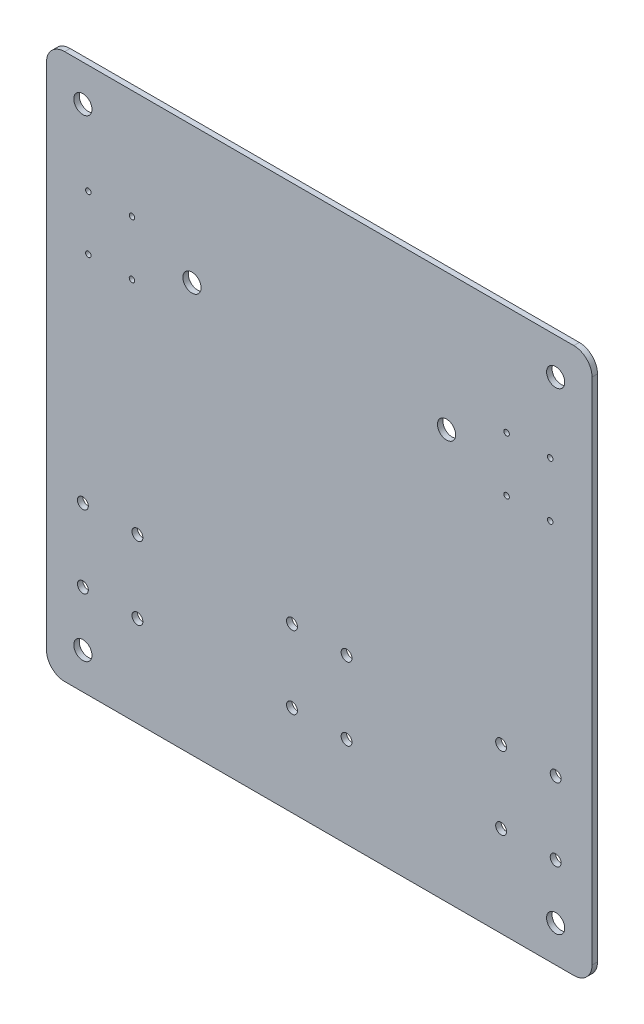
from build123d import *

# Parameters (mm, degrees)
SKETCH_1_W               = 300
SKETCH_1_H               = 300
EXTRUDE_1_DEPTH          = 3
SKETCH_2_R               = 1.5
CUT_EXTRUDE_1_DEPTH      = 213.153246499
FILLET_1_R               = 10
SKETCH_3_R               = 5
CUT_EXTRUDE_2_DEPTH      = 213.153246499
MIRROR_3_COPY_1_SKETCH_R = 5
MIRROR_3_COPY_1_DEPTH    = 213.153246499
SKETCH_4_R               = 5
CUT_EXTRUDE_3_DEPTH      = 213.153246499
SKETCH_5_R               = 3
CUT_EXTRUDE_4_DEPTH      = 213.153246499
SKETCH_6_R               = 3
CUT_EXTRUDE_5_DEPTH      = 213.153246499


with BuildPart() as part:
    # 草图1 → 凸台-拉伸1 (new body)
    with BuildSketch(Plane.XY):
        Rectangle(SKETCH_1_W, SKETCH_1_H)
    extrude(amount=EXTRUDE_1_DEPTH)

    # 草图2 → 切除-拉伸1 (cut, through all)
    with BuildSketch(Plane.XY.offset(3)):
        with Locations((103, 90)):
            Circle(SKETCH_2_R)
        with Locations((127, 90)):
            Circle(SKETCH_2_R)
        with Locations((103, 60)):
            Circle(SKETCH_2_R)
        with Locations((127, 60)):
            Circle(SKETCH_2_R)
    cut_extrude_1 = extrude(amount=-CUT_EXTRUDE_1_DEPTH, mode=Mode.SUBTRACT)

    # 镜向1: 切除-拉伸1 across plane
    add(cut_extrude_1.mirror(Plane(origin=(0, 0, 0), x_dir=(0, 0, 1), z_dir=(1, 0, 0))), mode=Mode.SUBTRACT)

    # 圆角1
    fillet_1_edges = [part.edges().sort_by_distance(p)[0] for p in [
        (-150, -150, 1.5),
        (150, -150, 1.5),
        (150, 150, 1.5),
        (-150, 150, 1.5),
    ]]
    fillet(fillet_1_edges, radius=FILLET_1_R)

    # 草图3 → 切除-拉伸2 (cut, through all)
    with BuildSketch(Plane.XY.offset(3)):
        with Locations((-130, 130)):
            Circle(SKETCH_3_R)
    cut_extrude_2 = extrude(amount=-CUT_EXTRUDE_2_DEPTH, mode=Mode.SUBTRACT)

    # 镜向2: 切除-拉伸2 across plane
    add(cut_extrude_2.mirror(Plane(origin=(0, 0, 0), x_dir=(0, 0, 1), z_dir=(1, 0, 0))), mode=Mode.SUBTRACT)

    # 镜向3: 切除-拉伸2 across plane
    add(cut_extrude_2.mirror(Plane.ZX), mode=Mode.SUBTRACT)

    # 镜向3 copy 1 sketch → 镜向3 copy 1 (cut, through all)
    with BuildSketch(Plane(origin=(0, 0, 3), x_dir=(-1, 0, 0), z_dir=(0, 0, 1))):
        with Locations((-130, 130)):
            Circle(MIRROR_3_COPY_1_SKETCH_R)
    extrude(amount=-MIRROR_3_COPY_1_DEPTH, mode=Mode.SUBTRACT)

    # 草图4 → 切除-拉伸3 (cut, through all)
    with BuildSketch(Plane.XY.offset(3)):
        with Locations((-70, 75)):
            Circle(SKETCH_4_R)
        with Locations((70, 75)):
            Circle(SKETCH_4_R)
    extrude(amount=-CUT_EXTRUDE_3_DEPTH, mode=Mode.SUBTRACT)

    # 草图5 → 切除-拉伸4 (cut, through all)
    with BuildSketch(Plane.XY.offset(3)):
        with Locations((-130, -100)):
            Circle(SKETCH_5_R)
        with Locations((-130, -60)):
            Circle(SKETCH_5_R)
        with Locations((-100, -60)):
            Circle(SKETCH_5_R)
        with Locations((-100, -100)):
            Circle(SKETCH_5_R)
    cut_extrude_4 = extrude(amount=-CUT_EXTRUDE_4_DEPTH, mode=Mode.SUBTRACT)

    # 镜向4: 切除-拉伸4 across plane
    add(cut_extrude_4.mirror(Plane(origin=(0, 0, 0), x_dir=(0, 0, 1), z_dir=(1, 0, 0))), mode=Mode.SUBTRACT)

    # 草图6 → 切除-拉伸5 (cut, through all)
    with BuildSketch(Plane.XY.offset(3)):
        with Locations((-15, -60)):
            Circle(SKETCH_6_R)
        with Locations((15, -60)):
            Circle(SKETCH_6_R)
        with Locations((-15, -100)):
            Circle(SKETCH_6_R)
        with Locations((15, -100)):
            Circle(SKETCH_6_R)
    extrude(amount=-CUT_EXTRUDE_5_DEPTH, mode=Mode.SUBTRACT)


solid = part.part
